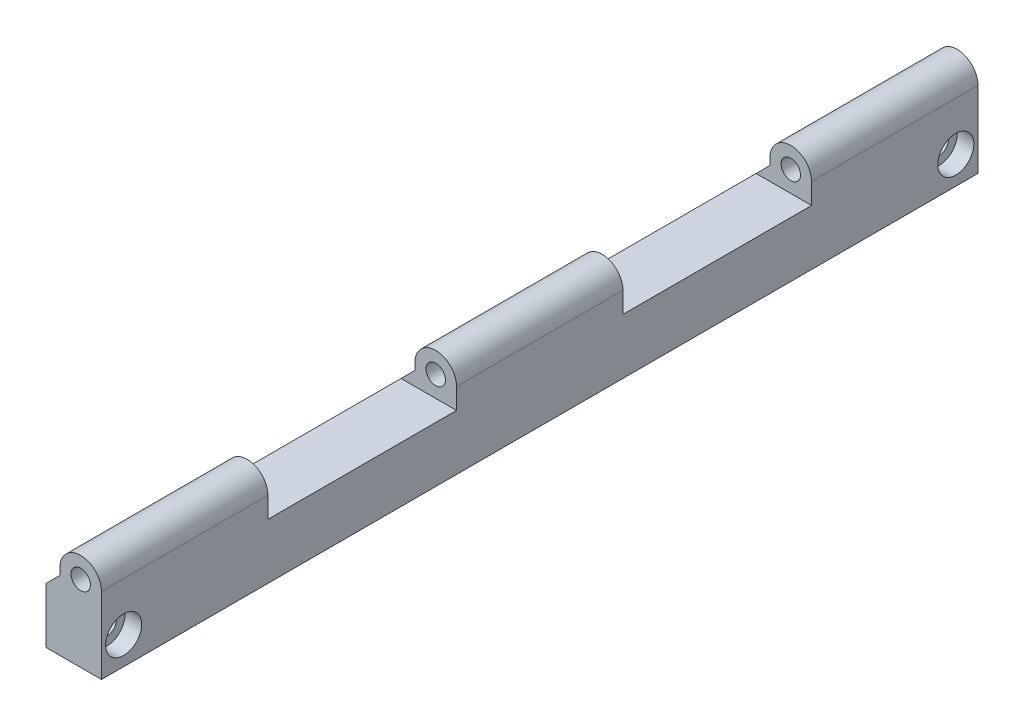
from build123d import *

# Parameters (mm, degrees)
ESQUISSE1_W                                     = 10
ESQUISSE1_H                                     = 10
BOSS_EXTRU_1_DEPTH                              = 79
ESQUISSE2_R                                     = 3.75
ESQUISSE2_R_2                                   = 1.75
BOSS_EXTRU_2_DEPTH                              = 30
R_P_TITION_LIN_AIRE1_COUNT                      = 3
R_P_TITION_LIN_AIRE1_PITCH                      = 64
CHAMBRAGE_POUR_VIS_T_TE_CYLINDRIQUE_D           = 3.4
CHAMBRAGE_POUR_VIS_T_TE_CYLINDRIQUE_CBORE_D     = 6.5
CHAMBRAGE_POUR_VIS_T_TE_CYLINDRIQUE_CBORE_DEPTH = 3
CHANFREIN1_SIZE                                 = 2.5


with BuildPart() as part:
    # Esquisse1 → Boss.-Extru.1 (new, symmetric)
    with BuildSketch(Plane.XY):
        Rectangle(ESQUISSE1_W, ESQUISSE1_H)
    extrude(amount=BOSS_EXTRU_1_DEPTH, both=True)

    # Esquisse2 → Boss.-Extru.2 (add)
    # profile 1 of 3: a face of its own
    with BuildSketch(Plane(origin=(0, 0, -79), x_dir=(-1, 0, 0), z_dir=(0, 0, -1))):
        with BuildLine():
            Line((-5, 5), (-1.25, 5))
            ThreePointArc((-1.25, 5), (-3.901650429, 6.098349571), (-5, 8.75))
            Line((-5, 8.75), (-5, 5))
        make_face()
    # profile 2 of 3: a face of its own
    with BuildSketch(Plane(origin=(0, 0, -79), x_dir=(-1, 0, 0), z_dir=(0, 0, -1))):
        with Locations((-1.25, 8.75)):
            Circle(ESQUISSE2_R)
        with Locations((-1.25, 8.75)):
            Circle(ESQUISSE2_R_2, mode=Mode.SUBTRACT)
    # profile 3 of 3: a face of its own
    with BuildSketch(Plane(origin=(0, 0, -79), x_dir=(-1, 0, 0), z_dir=(0, 0, -1))):
        with BuildLine():
            ThreePointArc((2.5, 8.75), (1.401650429, 6.098349571), (-1.25, 5))
            Line((-1.25, 5), (2.5, 5))
            Line((2.5, 5), (2.5, 8.75))
        make_face()
    boss_extru_2 = extrude(amount=-BOSS_EXTRU_2_DEPTH)

    # Répétition linéaire1: Boss.-Extru.2 ×3
    with Locations(*[(0, 0, i * R_P_TITION_LIN_AIRE1_PITCH) for i in range(1, R_P_TITION_LIN_AIRE1_COUNT)]):
        add(boss_extru_2)

    # Chambrage pour vis à tête cylindrique à 6 pans creux (ou vis CHC) M31 (through all)
    with Locations(Plane(origin=(5, 0, 0), x_dir=(0, 0, -1), z_dir=(1, 0, 0))):
        with Locations((-75, 0), (75, 0)):
            CounterBoreHole(CHAMBRAGE_POUR_VIS_T_TE_CYLINDRIQUE_D / 2, CHAMBRAGE_POUR_VIS_T_TE_CYLINDRIQUE_CBORE_D / 2, CHAMBRAGE_POUR_VIS_T_TE_CYLINDRIQUE_CBORE_DEPTH)

    # Chanfrein1
    chanfrein1_edges = [part.edges().sort_by_distance(p)[0] for p in [
        (-2.5, 5, 64),
        (-2.5, 5, 0),
        (-2.5, 5, -64),
    ]]
    chamfer(chanfrein1_edges, length=CHANFREIN1_SIZE - 0.0001)  # a hair under: the kernel refuses the full size


solid = part.part
